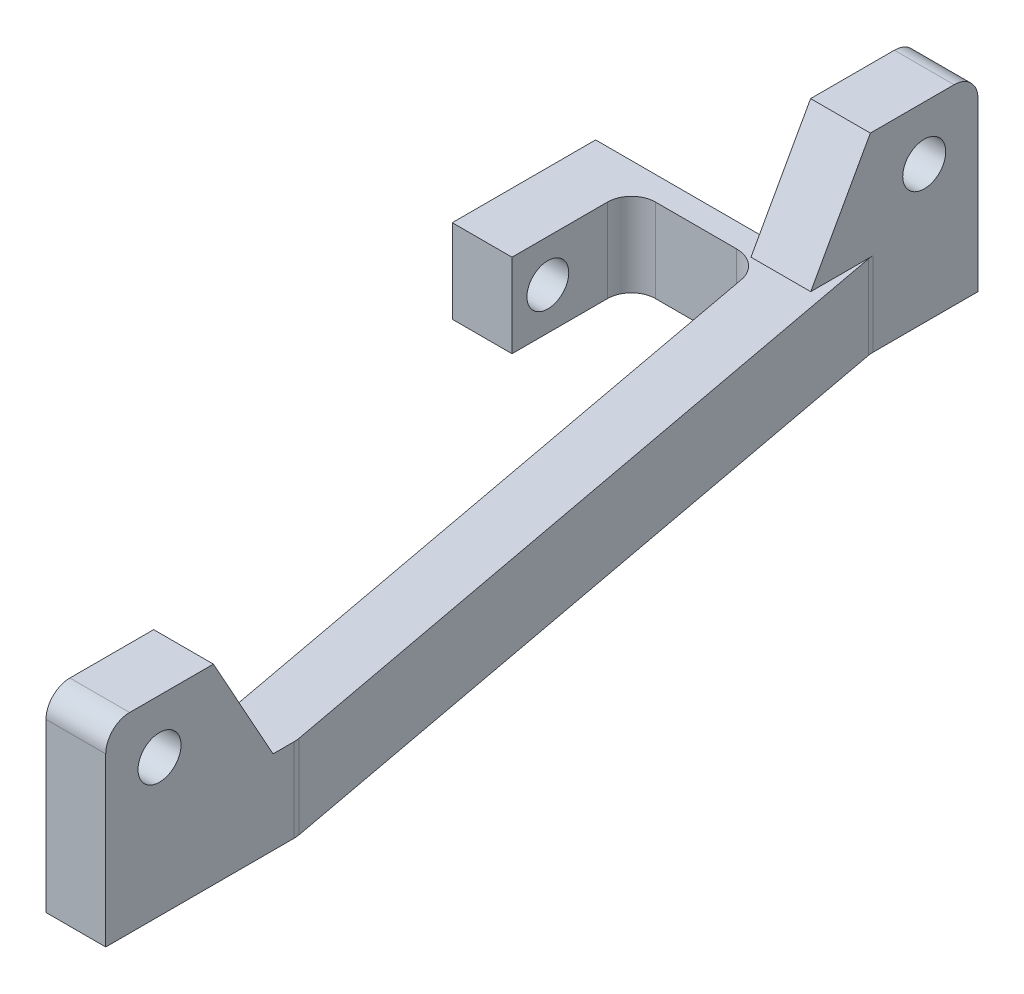
from build123d import *

# Parameters (mm, degrees)
BOSS_EXTRUDE1_DEPTH  = 7
BOSS_EXTRUDE2_START  = 7
SKETCH1_3_W          = 5
SKETCH1_3_H          = 9
BOSS_EXTRUDE2_DEPTH  = 9
M3_CLEARANCE_HOLE1_D = 3.6
FILLET2_R            = 2.5
CHAMFER3_SIZE        = 5
CHAMFER3_SIZE_2      = 9.020238776
CHAMFER2_SIZE        = 3
SKETCH6_W            = 5
SKETCH6_H            = 7
BOSS_EXTRUDE3_DEPTH  = 10
SKETCH7_R            = 1.75
CUT_EXTRUDE1_DEPTH   = 10
FILLET6_R            = 2
SKETCH8_W            = 84
SKETCH8_H            = 16
CUT_EXTRUDE2_DEPTH   = 26
FILLET8_R            = 2


with BuildPart() as part:
    # Sketch1 → Boss-Extrude1 (new body)
    with BuildSketch(Plane(origin=(0, 0, 0), x_dir=(1, 0, 0), z_dir=(0, 1, 0))):
        Polygon((-23.5, -9), (-23.5, 0), (-23.413842004, 5), (-23.413842004, 7), (-13.346045394, 61), (13.346045394, 61), (23.413842004, 7), (23.413842004, 5), (23.5, 0), (23.5, -9), (28.5, -9), (28.5, 7), (17.5, 66), (17.5, 75), (12.5, 75), (12.5, 66), (-12.5, 66), (-12.5, 75), (-17.5, 75), (-17.5, 66), (-28.5, 7), (-28.5, -9), align=None)
    extrude(amount=BOSS_EXTRUDE1_DEPTH)

    # Sketch1<3> → Boss-Extrude2 (add)
    with BuildSketch(Plane(origin=(0, 0, 0), x_dir=(1, 0, 0), z_dir=(0, 1, 0)).offset(BOSS_EXTRUDE2_START)):
        with Locations((-15, 70.5)):
            Rectangle(SKETCH1_3_W, SKETCH1_3_H)
        with Locations((15, 70.5)):
            Rectangle(SKETCH1_3_W, SKETCH1_3_H)
        with Locations((-26, -4.5)):
            Rectangle(SKETCH1_3_W, SKETCH1_3_H)
        with Locations((26, -4.5)):
            Rectangle(SKETCH1_3_W, SKETCH1_3_H)
    extrude(amount=BOSS_EXTRUDE2_DEPTH)

    # M3 Clearance Hole1 (through all)
    with Locations(Plane(origin=(28.5, 0, 0), x_dir=(0, 0, -1), z_dir=(1, 0, 0))):
        with Locations((-4.5, 11.5), (70.5, 11.5)):
            Hole(M3_CLEARANCE_HOLE1_D / 2)

    # Fillet2
    fillet2_edges = [part.edges().sort_by_distance(p)[0] for p in [
        (-28.5, 3.5, -7),
        (-17.5, 3.5, -66),
        (17.5, 3.5, -66),
        (28.5, 3.5, -7),
        (23.413842004, 3.5, -5),
        (23.413842004, 3.5, -7),
        (13.346045394, 3.5, -61),
        (-13.346045394, 3.5, -61),
        (-23.413842004, 3.5, -7),
        (-23.413842004, 3.5, -5),
    ]]
    fillet(fillet2_edges, radius=FILLET2_R)

    # Chamfer3
    # the kernel refuses this chamfer: 9.020238776, 5 mm, written as the material it adds along each edge
    with BuildSketch(Plane(origin=(0.156378648, 7, 0), x_dir=(1.7315070193455174e-15, -0.060867759165289366, -0.9981458389905739), z_dir=(1, 0, 0))) as chamfer3_piece_1_section:
        Polygon((CHAMFER3_SIZE * 0.998145838991, CHAMFER3_SIZE * 0.0608677591653), (-CHAMFER3_SIZE_2 * 0.0608677591677, CHAMFER3_SIZE_2 * 0.99814583903), (0, 0), align=None)
    chamfer3_piece_1 = extrude(amount=28.343621352, mode=Mode.PRIVATE)
    chamfer3_piece_1 = split(chamfer3_piece_1, bisect_by=Plane(origin=(23.456927395, 9.255059618, -2.499628978), z_dir=(0.9998515690487569, 0, -0.017229041492165368)), keep=Keep.TOP, mode=Mode.PRIVATE)
    chamfer3_piece_1 = split(chamfer3_piece_1, bisect_by=Plane(origin=(23.478460501, 16, -2.500000028), z_dir=(0, -1, 0)), keep=Keep.TOP, mode=Mode.PRIVATE)
    add(chamfer3_piece_1)
    with BuildSketch(Plane(origin=(12.5, 7, -66), x_dir=(0, -0.06086775916528939, 0.9981458389905739), z_dir=(1, 0, 0))) as chamfer3_piece_2_section:
        Polygon((CHAMFER3_SIZE * 0.998145838991, -CHAMFER3_SIZE * 0.0608677591653), (-CHAMFER3_SIZE_2 * 0.0608677591677, -CHAMFER3_SIZE_2 * 0.99814583903), (0, 0), align=None)
    chamfer3_piece_2 = extrude(amount=5, mode=Mode.PRIVATE)
    chamfer3_piece_2 = split(chamfer3_piece_2, bisect_by=Plane(origin=(15, 16, -64.333324962), z_dir=(0, -1, 0)), keep=Keep.TOP, mode=Mode.PRIVATE)
    add(chamfer3_piece_2)

    # Chamfer2
    chamfer2_edges = [part.edges().sort_by_distance(p)[0] for p in [
        (0, 7, -66),
    ]]
    chamfer(chamfer2_edges, length=CHAMFER2_SIZE)

    # Sketch6 → Boss-Extrude3 (add)
    with BuildSketch(Plane(origin=(0, 0, -61), x_dir=(-1, 0, 0), z_dir=(0, 0, 1))):
        with Locations((0, -3.5)):
            Rectangle(SKETCH6_W, SKETCH6_H)
    extrude(amount=BOSS_EXTRUDE3_DEPTH)

    # Sketch7 → Cut-Extrude1 (cut)
    with BuildSketch(Plane(origin=(2.5, 0, 0), x_dir=(0, 0, -1), z_dir=(1, 0, 0))):
        with Locations((54, 3.5)):
            Circle(SKETCH7_R)
    extrude(amount=-CUT_EXTRUDE1_DEPTH, mode=Mode.SUBTRACT)

    # Fillet6
    fillet6_edges = [part.edges().sort_by_distance(p)[0] for p in [
        (26, 16, 9),
        (-15, 16, -75),
        (15, 16, -75),
        (-26, 16, 9),
    ]]
    fillet(fillet6_edges, radius=FILLET6_R)

    # Sketch8 → Cut-Extrude2 (cut)
    with BuildSketch(Plane.ZY.offset(28.5)):
        with Locations((-33, 8)):
            Rectangle(SKETCH8_W, SKETCH8_H)
    extrude(amount=-CUT_EXTRUDE2_DEPTH, mode=Mode.SUBTRACT)

    # Fillet8
    fillet8_edges = [part.edges().sort_by_distance(p)[0] for p in [
        (2.5, 3.5, -61),
    ]]
    fillet(fillet8_edges, radius=FILLET8_R)


solid = part.part
